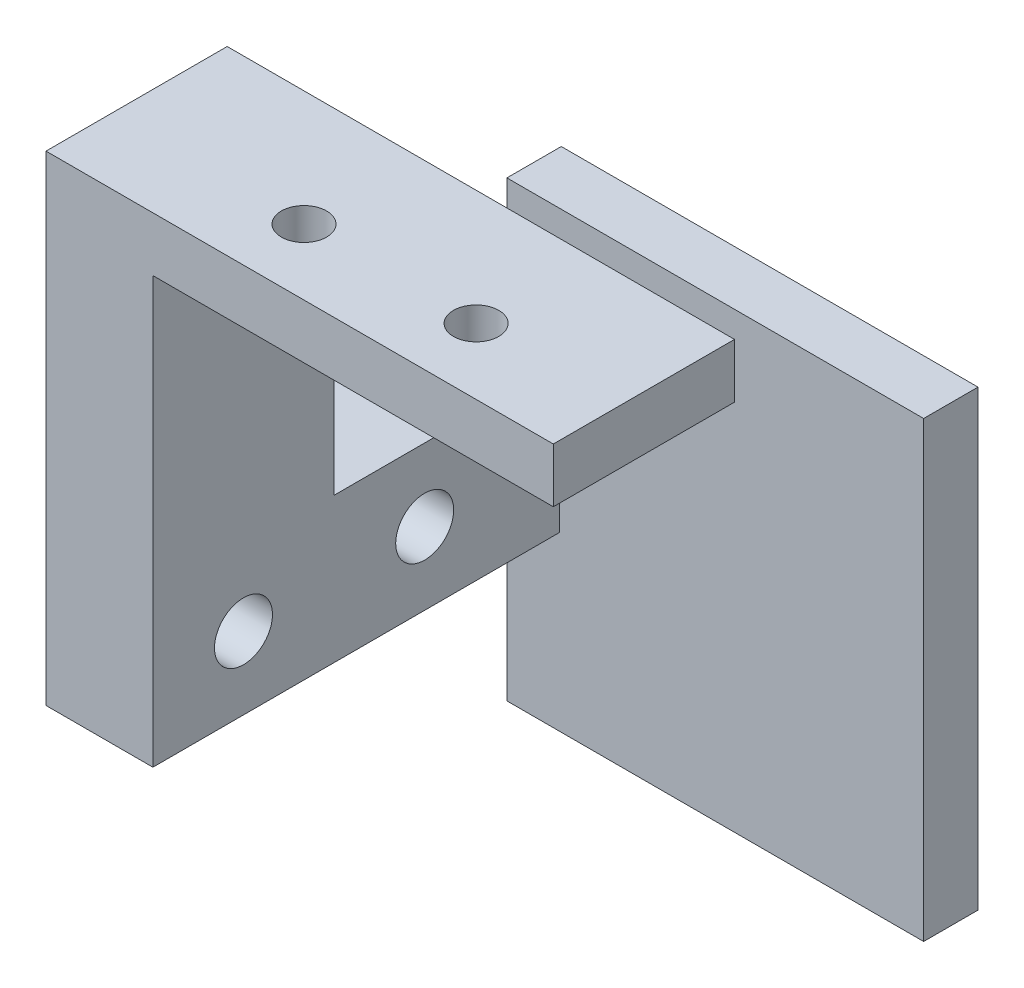
from build123d import *

# Parameters (mm, degrees)
SKETCH1_W               = 25
SKETCH1_H               = 10
BOSS_EXTRUDE1_DEPTH     = 3
SKETCH2_R               = 1.25
CUT_EXTRUDE1_DEPTH      = 10
SKETCH3_W               = 10
SKETCH3_H               = 3
BOSS_EXTRUDE2_DEPTH     = 3
SKETCH4_W               = 3
SKETCH4_H               = 19.36
BOSS_EXTRUDE3_DEPTH     = 10
BOSS_EXTRUDE4_DEPTH     = 3
SKETCH6_W               = 3
SKETCH6_H               = 25
BOSS_EXTRUDE5_DEPTH     = 23
SKETCH7_W               = 3
SKETCH7_H               = 15.439035089
BOSS_EXTRUDE6_DEPTH     = 5
BOSS_EXTRUDE7_DEPTH     = 2.9
BOSS_EXTRUDE8_DEPTH     = 10
CUT_EXTRUDE2_DEPTH      = 10
CUT_EXTRUDE3_DEPTH      = 42.797000958
CUT_EXTRUDE3_DEPTH_BACK = 42.797000958
SKETCH11_R              = 1.25
SKETCH12_R              = 1.6
CUT_EXTRUDE4_DEPTH      = 40


with BuildPart() as part:
    # Sketch1 → Boss-Extrude1 (new body)
    with BuildSketch(Plane(origin=(0, 0, 0), x_dir=(1, 0, 0), z_dir=(0, 1, 0))):
        Rectangle(SKETCH1_W, SKETCH1_H)
    extrude(amount=BOSS_EXTRUDE1_DEPTH)

    # Sketch2 → Cut-Extrude1 (cut)
    with BuildSketch(Plane(origin=(0, 3, 0), x_dir=(1, 0, 0), z_dir=(0, 1, 0))):
        with Locations((-4.894136616, -1.366933975)):
            Circle(SKETCH2_R)
        with Locations((4.605863384, -1.366933975)):
            Circle(SKETCH2_R)
    extrude(amount=-CUT_EXTRUDE1_DEPTH, mode=Mode.SUBTRACT)

    # Sketch3 → Boss-Extrude2 (add)
    with BuildSketch(Plane.ZY.offset(12.5)):
        with Locations((0, 1.5)):
            Rectangle(SKETCH3_W, SKETCH3_H)
    extrude(amount=BOSS_EXTRUDE2_DEPTH)

    # Sketch4 → Boss-Extrude3 (add)
    with BuildSketch(Plane(origin=(0, 0, -5), x_dir=(-1, 0, 0), z_dir=(0, 0, -1))):
        with Locations((14, -9.68)):
            Rectangle(SKETCH4_W, SKETCH4_H)
    extrude(amount=-BOSS_EXTRUDE3_DEPTH)

    # Sketch5 → Boss-Extrude4 (add)
    with BuildSketch(Plane.ZY.offset(15.5)):
        Polygon((5, -19.36), (5, -22.36), (-17.439050417, -22.36), (-20.439050417, -22.36), (-20.439050417, -19.359965116), (-17.439050417, -19.359965116), align=None)
    extrude(amount=-BOSS_EXTRUDE4_DEPTH)

    # Sketch6 → Boss-Extrude5 (add)
    with BuildSketch(Plane(origin=(-12.5, 0, 0), x_dir=(0, 0, -1), z_dir=(1, 0, 0))):
        with Locations((18.939050417, -19.359753222)):
            Rectangle(SKETCH6_W, SKETCH6_H)
    extrude(amount=BOSS_EXTRUDE5_DEPTH)


with BuildPart() as boss_extrude6_tool:
    # Sketch7 → Boss-Extrude6 (new body)
    with BuildSketch(Plane(origin=(0, -19.359992227, -3.0098e-05), x_dir=(1, 0, 0), z_dir=(0, 0.9999999999987916, 1.5546330463646684e-06))):
        with Locations((-14, 12.719522209)):
            Rectangle(SKETCH7_W, SKETCH7_H)
    extrude(amount=BOSS_EXTRUDE6_DEPTH)


with BuildPart() as part_1:
    add(part.part)


with BuildPart() as part_2:
    # Boss-Extrude6: joined with boss_extrude6_tool
    add(part_1.part.fuse(boss_extrude6_tool.part, tol=0.00001))

    # Sketch8 → Boss-Extrude7 (add)
    with BuildSketch(Plane(origin=(-12.5, 0, 0), x_dir=(0, 0, -1), z_dir=(1, 0, 0))):
        Polygon((17.439050417, -22.36), (-5, -22.36), (-5, 0), (5, 0), (5.000026988, -14.359984454), (17.439050417, -14.359962784), align=None)
    extrude(amount=BOSS_EXTRUDE7_DEPTH)

    # Sketch9 → Boss-Extrude8 (add)
    with BuildSketch(Plane(origin=(0, 0, -5), x_dir=(-1, 0, 0), z_dir=(0, 0, -1))):
        Polygon((1, 1.140246778), (15.5, 1.140246778), (15.5, 4.140246778), (-12.5, 4.140246778), (-12.5, 1.140246778), align=None)
    extrude(amount=-BOSS_EXTRUDE8_DEPTH)

    # Sketch10 → Cut-Extrude2 (cut)
    with BuildSketch(Plane(origin=(0, 0, -5), x_dir=(-1, 0, 0), z_dir=(0, 0, -1))):
        Polygon((-10.464750731, 1.14), (9.6, 1.14), (9.6, 0), (-12.5, 0), (-12.5, 1.14), align=None)
    extrude(amount=-CUT_EXTRUDE2_DEPTH, mode=Mode.SUBTRACT)

    # Sketch11 → Cut-Extrude3 (cut, two sides: drawn at the far end of the back side and taken through both)
    with BuildSketch(Plane.XZ.offset(-1.14).offset(-CUT_EXTRUDE3_DEPTH_BACK)):
        with Locations((-4.894136616, 1.366933975)):
            Circle(SKETCH11_R)
        with Locations((4.605863384, 1.366933975)):
            Circle(SKETCH11_R)
    extrude(amount=CUT_EXTRUDE3_DEPTH + CUT_EXTRUDE3_DEPTH_BACK, mode=Mode.SUBTRACT)

    # Sketch12 → Cut-Extrude4 (cut)
    with BuildSketch(Plane.ZY.offset(15.5)):
        with Locations((-1.8211e-05, -18.359986331)):
            Circle(SKETCH12_R)
        with Locations((-10.000013494, -18.359992227)):
            Circle(SKETCH12_R)
    extrude(amount=-CUT_EXTRUDE4_DEPTH, mode=Mode.SUBTRACT)


solid = part_2.part
